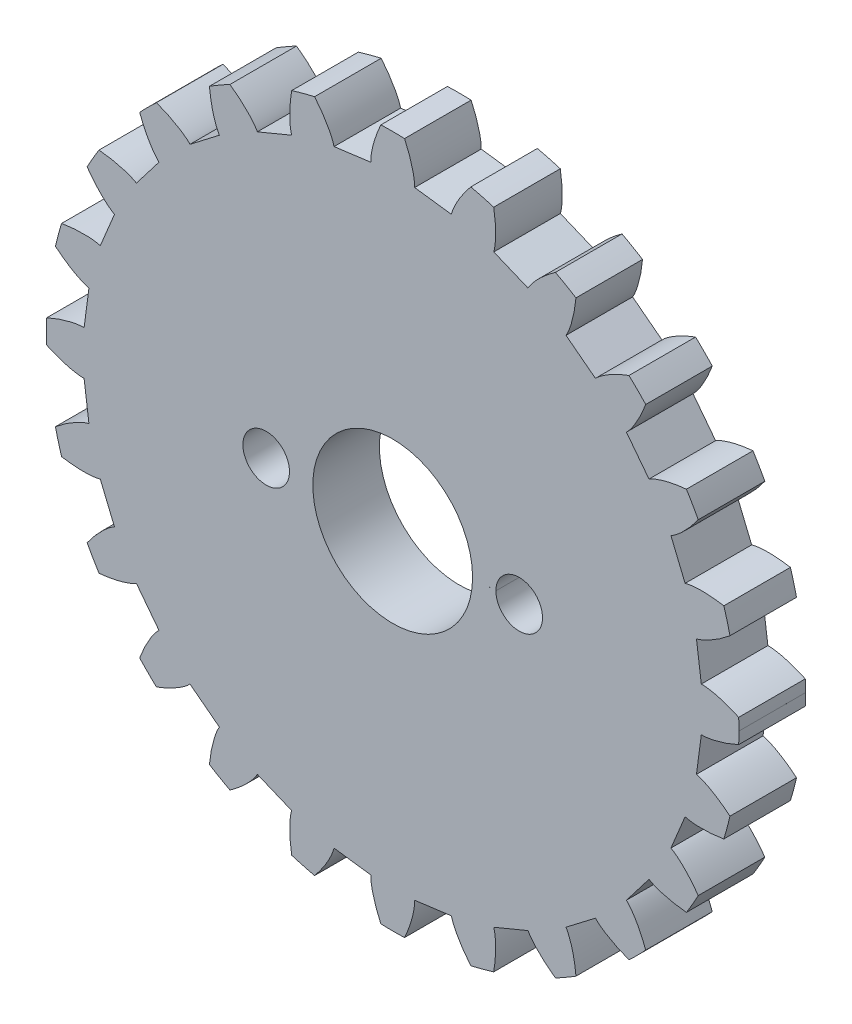
from build123d import *

# Parameters (mm, degrees)
SKETCH1_W               = 26
SKETCH1_H               = 5
REVOLVE1_ANGLE          = 359.999695921
CUT_EXTRUDE2_DEPTH      = 6
CIRPATTERN2_COUNT       = 24
CUT_EXTRUDE4_DEPTH      = 7
CUT_EXTRUDE4_DEPTH_BACK = 7
SKETCH3_R               = 6
SKETCH3_R_2             = 1.75


with BuildPart() as part:
    # Sketch1 → Revolve1 (revolve)
    with BuildSketch(Plane(origin=(0, 0, 0), x_dir=(1, 0, 0), z_dir=(0, 1, 0))):
        with Locations((13, -2.5)):
            Rectangle(SKETCH1_W, SKETCH1_H)
    revolve(axis=Axis((0, 0, 1), (0, 0, 1)), revolution_arc=REVOLVE1_ANGLE)

    # Sketch2 → Cut-Extrude2 (cut, symmetric)
    with BuildSketch(Plane.XY):
        with BuildLine():
            add(Edge.make_bspline(
                [(23.177011452, 1.648214839), (23.181334508, 1.648476152), (23.193469167, 1.649066898), (23.21644737, 1.649622191), (23.253990407, 1.649730291), (23.301893166, 1.648694511), (23.363877463, 1.646007435), (23.436976629, 1.641106961), (23.517385457, 1.633902808), (23.604936789, 1.624101126), (23.692334914, 1.612585168), (23.779559647, 1.599479511), (23.866480028, 1.584964537), (23.97179544, 1.565656387), (24.098109724, 1.540104733), (24.245772691, 1.506741047), (24.413250584, 1.464772789), (24.583915466, 1.417582652), (24.751819259, 1.367517322), (24.921399292, 1.312757179), (25.085429511, 1.256815406), (25.255708411, 1.19442981), (25.412835504, 1.134668966), (25.588734702, 1.062978326), (25.730647904, 1.003740753), (25.877106617, 0.938597761), (25.948367996, 0.906309242), (25.984777755, 0.889562166)],
                knots=[4.9e-08, 4.9e-08, 4.9e-08, 4.9e-08, 4.9e-08, 0.005376749, 0.015083688, 0.02853182, 0.04661014, 0.064854849, 0.092110526, 0.119476176, 0.146842496, 0.174208854, 0.201574956, 0.228941013, 0.256307345, 0.307035032, 0.361767352, 0.416499661, 0.471231937, 0.525964282, 0.580696616, 0.635428982, 0.690161387, 0.744893688, 0.799626082, 0.854358407, 0.909090945, 0.909090945, 0.909090945, 0.909090945, 0.909090945], degree=4))
            add(Edge.make_bspline(
                [(25.984777755, 0.889562166), (26.326337644, 0.901255077), (27.022297624, 0.925080551), (28.753438041, 0.984344362), (30.156496922, 1.032376639), (32.175730812, 1.101503033), (33.880296874, 1.159857098), (35.848494254, 1.22723631), (37.694657729, 1.290437817), (39.650617192, 1.357398076), (41.531074843, 1.421773609), (43.432052562, 1.486851625), (45.27081659, 1.549799819), (47.012870983, 1.609437258), (48.716308198, 1.667752678), (50.22847828, 1.719520265), (51.638447234, 1.767789101), (52.961301877, 1.813075668), (54.260530168, 1.857553412), (55.450552976, 1.898292618), (56.867671345, 1.946806207), (57.895610662, 1.981996652), (59.165556981, 2.025471957), (59.698554144, 2.043718567), (59.964752001, 2.052831576)],
                knots=[0.083333333, 0.083333333, 0.083333333, 0.083333333, 0.083333333, 0.123540522, 0.166752518, 0.20939217, 0.256181319, 0.300394918, 0.346611722, 0.394831731, 0.442050137, 0.489268544, 0.532909799, 0.580271291, 0.622910943, 0.660113324, 0.699652778, 0.729462378, 0.759701236, 0.792420253, 0.822587569, 0.854042659, 0.885330815, 0.916666667, 0.916666667, 0.916666667, 0.916666667, 0.916666667], degree=4))
            add(Edge.make_bspline(
                [(59.964752001, 2.052831576), (59.960814186, 2.167858114), (59.952297358, 2.391864205), (59.929164639, 2.956118344), (59.904214054, 3.387496151), (59.867605218, 4.011105795), (59.829864935, 4.51860188), (59.784692875, 5.095593464), (59.735840758, 5.630008668), (59.681149933, 6.189197163), (59.621758447, 6.733032502), (59.557276862, 7.284499224), (59.487467195, 7.831673622), (59.413279, 8.378271577), (59.332833338, 8.927636588), (59.249446165, 9.468312835), (59.157544813, 10.022602471), (59.066415503, 10.551451777), (58.960711951, 11.120474239), (58.865816613, 11.620445718), (58.739775981, 12.232281443), (58.652227604, 12.655418094), (58.528532377, 13.206432928), (58.478781958, 13.425010514), (58.452814537, 13.537136799)],
                knots=[0.083333333, 0.083333333, 0.083333333, 0.083333333, 0.083333333, 0.123015873, 0.162698413, 0.202380952, 0.242063492, 0.281746032, 0.321428571, 0.361111111, 0.400793651, 0.44047619, 0.48015873, 0.51984127, 0.55952381, 0.599206349, 0.638888889, 0.678571429, 0.718253968, 0.757936508, 0.797619048, 0.837301587, 0.876984127, 0.916666667, 0.916666667, 0.916666667, 0.916666667, 0.916666667], degree=4))
            add(Edge.make_bspline(
                [(58.452814537, 13.537136799), (58.20964739, 13.480821513), (57.763573408, 13.377514862), (56.725391472, 13.137081428), (55.8234494, 12.9281999), (54.568002695, 12.637449934), (53.442908126, 12.37688833), (52.051066759, 12.054550609), (50.599185378, 11.71830817), (49.050388981, 11.359621101), (47.456325392, 10.990450564), (45.863179114, 10.621492469), (44.310239505, 10.261845869), (42.761818753, 9.903245796), (41.19068425, 9.539385426), (39.606325736, 9.172462496), (38.04283385, 8.810372086), (36.384968272, 8.426425592), (34.823246198, 8.064745055), (33.059291031, 7.656229184), (31.526671947, 7.301288632), (29.630406056, 6.862130808), (28.296636624, 6.553242016), (26.46186913, 6.128326658), (25.742799277, 5.961796662), (25.329603628, 5.866104331)],
                knots=[0.083333333, 0.083333333, 0.083333333, 0.083333333, 0.083333333, 0.112698499, 0.136843192, 0.163042686, 0.191354652, 0.22865676, 0.25743007, 0.29840472, 0.340289918, 0.382675918, 0.419052302, 0.457932692, 0.497207653, 0.537818085, 0.578079473, 0.616034139, 0.656644571, 0.701140006, 0.741113054, 0.783999854, 0.826385854, 0.866768648, 0.916666667, 0.916666667, 0.916666667, 0.916666667, 0.916666667], degree=4))
            add(Edge.make_bspline(
                [(22.813863401, 4.406598729), (22.818106786, 4.407465209), (22.829980863, 4.410035274), (22.852319823, 4.415446098), (22.88861159, 4.425058535), (22.934614023, 4.438457167), (22.993790789, 4.457095399), (23.063130826, 4.48074835), (23.138935217, 4.508518364), (23.220966449, 4.540646014), (23.302406005, 4.574389875), (23.383266634, 4.60962439), (23.463468523, 4.646141428), (23.560198082, 4.692049302), (23.675595057, 4.749422847), (23.809591373, 4.819867681), (23.960500411, 4.903752374), (24.113136321, 4.993505868), (24.26236107, 5.085321962), (24.411989837, 5.182106741), (24.555952065, 5.278596488), (24.704282272, 5.382927769), (24.840588144, 5.481319796), (24.991938819, 5.596093699), (25.113684634, 5.690042641), (25.238292641, 5.790872243), (25.298768964, 5.840504359), (25.329603628, 5.866104331)],
                knots=[0, 0, 0, 0, 0, 0.005376749, 0.015083688, 0.02853182, 0.04661014, 0.064854849, 0.092110526, 0.119476176, 0.146842496, 0.174208854, 0.201574956, 0.228941013, 0.256307345, 0.307035032, 0.361767352, 0.416499661, 0.471231937, 0.525964282, 0.580696616, 0.635428982, 0.690161387, 0.744893688, 0.799626082, 0.854358407, 0.909090914, 0.909090914, 0.909090914, 0.909090914, 0.909090914], degree=4))
            add(Edge.make_bspline(
                [(22.813863401, 4.406598729), (22.817584815, 4.378331786), (22.824435682, 4.326294289), (22.843127325, 4.184317157), (22.856700715, 4.081217025), (22.877221208, 3.925348406), (22.893988729, 3.79798644), (22.912784591, 3.655217697), (22.929847095, 3.525615107), (22.94758374, 3.390891914), (22.963787833, 3.267809614), (22.980920206, 3.137676314), (22.998141151, 3.006870255), (23.01614685, 2.870103392), (23.034495263, 2.730733359), (23.053237156, 2.588374548), (23.071092368, 2.452750745), (23.090657146, 2.3041415), (23.107541818, 2.175889682), (23.129513893, 2.008995205), (23.144430986, 1.895688635), (23.164837088, 1.740688902), (23.172880923, 1.679589913), (23.177011452, 1.648214839)],
                knots=[0.083333333, 0.083333333, 0.083333333, 0.083333333, 0.083333333, 0.124323918, 0.163161058, 0.206805889, 0.246995192, 0.28891226, 0.331780849, 0.370108841, 0.409254808, 0.448242187, 0.482805823, 0.525716146, 0.568843483, 0.611703726, 0.653695913, 0.694185697, 0.738247863, 0.782176482, 0.823818109, 0.87116887, 0.916666667, 0.916666667, 0.916666667, 0.916666667, 0.916666667], degree=4))
        make_face()
    cut_extrude2 = extrude(amount=CUT_EXTRUDE2_DEPTH, both=True, mode=Mode.SUBTRACT)

    # CirPattern2: Cut-Extrude2 ×24 about axis
    cirpattern2_axis = Axis((0, 0, 5), (0, 0, -1))
    for i in range(1, CIRPATTERN2_COUNT):
        add(cut_extrude2.rotate(cirpattern2_axis, i * 360 / CIRPATTERN2_COUNT), mode=Mode.SUBTRACT)

    # Sketch3 → Cut-Extrude4 (cut, two sides: drawn at the far end of the back side and taken through both)
    with BuildSketch(Plane.XY.offset(-CUT_EXTRUDE4_DEPTH_BACK)):
        Circle(SKETCH3_R)
        with Locations((9.5, 0)):
            Circle(SKETCH3_R_2)
        with Locations((-9.5, 0)):
            Circle(SKETCH3_R_2)
    extrude(amount=CUT_EXTRUDE4_DEPTH + CUT_EXTRUDE4_DEPTH_BACK, mode=Mode.SUBTRACT)


solid = part.part
